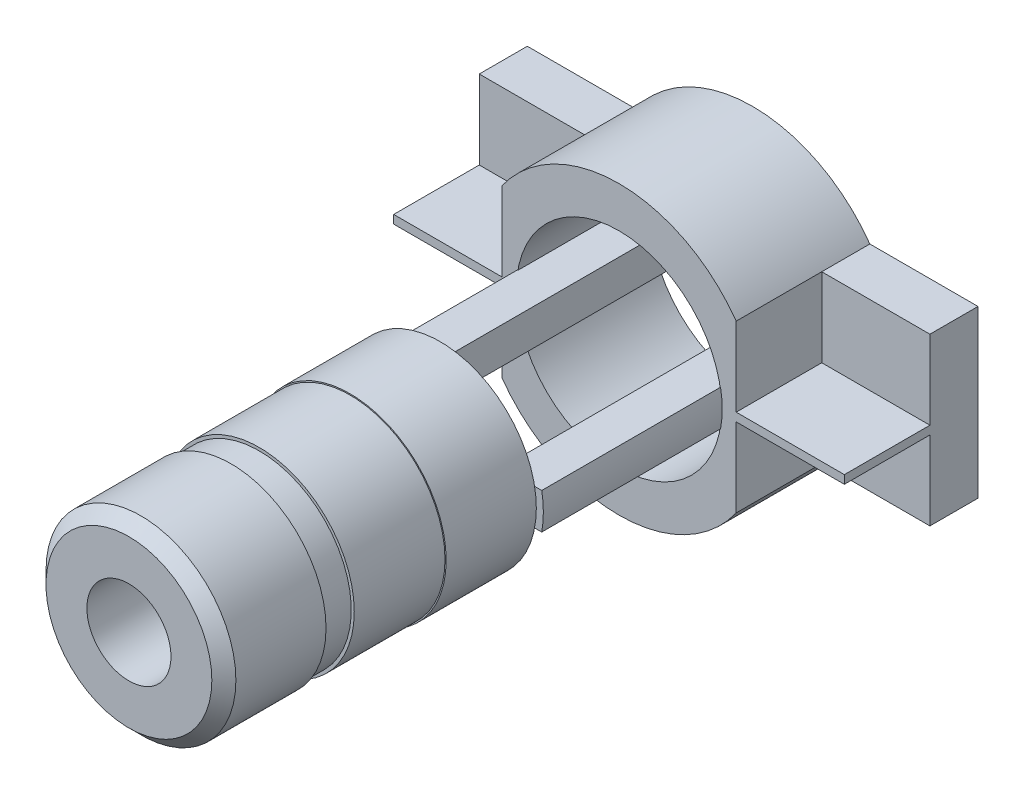
from build123d import *

# Parameters (mm, degrees)
SKETCH1_R             = 7.9
SKETCH1_R_2           = 3.5
BOSS_EXTRUDE1_DEPTH   = 18.4
CHAMFER1_SIZE         = 1
CUT_EXTRUDE6_START    = 2.35
SKETCH19_R            = 7.9
SKETCH19_R_2          = 7.65
CUT_EXTRUDE6_DEPTH    = 2.35
SKETCH24_R            = 8
BOSS_EXTRUDE5_DEPTH   = 7.5
BOSS_EXTRUDE6_DEPTH   = 26
BOSS_EXTRUDE6_2_DEPTH = 26
SKETCH26_R            = 11.95
SKETCH26_R_2          = 8.55
BOSS_EXTRUDE7_DEPTH   = 11.12
CUT_EXTRUDE9_DEPTH    = 45.143101386
SKETCH28_R            = 3.5
CUT_EXTRUDE10_DEPTH   = 31.230200132
SKETCH29_W            = 4
SKETCH29_H            = 13.818827736
BOSS_EXTRUDE8_DEPTH   = 9
SKETCH30_W            = 4
SKETCH30_H            = 13.818827736
BOSS_EXTRUDE9_DEPTH   = 9
BOSS_EXTRUDE10_DEPTH  = 9
BOSS_EXTRUDE11_DEPTH  = 9


with BuildPart() as part:
    # Sketch1 → Boss-Extrude1 (new body)
    with BuildSketch(Plane.XY):
        Circle(SKETCH1_R)
        Circle(SKETCH1_R_2, mode=Mode.SUBTRACT)
    extrude(amount=BOSS_EXTRUDE1_DEPTH)

    # Chamfer1
    chamfer1_edges = [part.edges().sort_by_distance(p)[0] for p in [
        (-7.9, 0, 18.4),
    ]]
    chamfer(chamfer1_edges, length=CHAMFER1_SIZE)

    # Sketch19 → Cut-Extrude6 (cut)
    with BuildSketch(Plane(origin=(0, 0, 9.9), x_dir=(-1, 0, 0), z_dir=(0, 0, -1)).offset(CUT_EXTRUDE6_START)):
        Circle(SKETCH19_R)
        Circle(SKETCH19_R_2, mode=Mode.SUBTRACT)
    extrude(amount=-CUT_EXTRUDE6_DEPTH, mode=Mode.SUBTRACT)


with BuildPart() as body_2:
    # Sketch24 → Boss-Extrude5 (new body)
    with BuildSketch(Plane(origin=(0, 0, 0), x_dir=(-1, 0, 0), z_dir=(0, 0, -1))):
        Circle(SKETCH24_R)
    extrude(amount=BOSS_EXTRUDE5_DEPTH)

    # Sketch28 → Cut-Extrude10 (cut, through all)
    with BuildSketch(Plane(origin=(0, 0, -7.5), x_dir=(-1, 0, 0), z_dir=(0, 0, -1))):
        Circle(SKETCH28_R)
    extrude(amount=-CUT_EXTRUDE10_DEPTH, mode=Mode.SUBTRACT)


with BuildPart() as body_3:
    # Sketch25 → Boss-Extrude6 (new body)
    with BuildSketch(Plane(origin=(0, 0, -7.5), x_dir=(-1, 0, 0), z_dir=(0, 0, -1))):
        with BuildLine():
            Line((-5.15, 1.5), (-8.45, 1.5))
            ThreePointArc((-8.45, 1.5), (-8.549984118, 0.752960074), (-8.583399735, 0))
            ThreePointArc((-8.583399735, 0), (-8.549984118, -0.752960074), (-8.45, -1.5))
            Line((-8.45, -1.5), (-5.15, -1.5))
            Line((-5.15, -1.5), (-5.15, 0))
            Line((-5.15, 0), (-5.15, 1.5))
        make_face()
    extrude(amount=BOSS_EXTRUDE6_DEPTH)


with BuildPart() as body_4:
    # Sketch25 → Boss-Extrude6 2 (new body)
    with BuildSketch(Plane(origin=(0, 0, -7.5), x_dir=(-1, 0, 0), z_dir=(0, 0, -1))):
        with BuildLine():
            Line((5.15, 1.5), (5.15, 0))
            Line((5.15, 0), (5.15, -1.5))
            Line((5.15, -1.5), (8.45, -1.5))
            ThreePointArc((8.45, -1.5), (8.549984118, -0.752960074), (8.583399735, 0))
            ThreePointArc((8.583399735, 0), (8.549984118, 0.752960074), (8.45, 1.5))
            Line((8.45, 1.5), (5.15, 1.5))
        make_face()
    extrude(amount=BOSS_EXTRUDE6_2_DEPTH)


with BuildPart() as body_5:
    # Sketch26 → Boss-Extrude7 (new body)
    with BuildSketch(Plane(origin=(0, 0, -33.5), x_dir=(-1, 0, 0), z_dir=(0, 0, -1))):
        Circle(SKETCH26_R)
        Circle(SKETCH26_R_2, mode=Mode.SUBTRACT)
    extrude(amount=-BOSS_EXTRUDE7_DEPTH)

    # Sketch27 → Cut-Extrude9 (cut, through all)
    with BuildSketch(Plane.XY.offset(-22.38)):
        with BuildLine():
            Line((-9.75, 0), (-9.75, 6.909413868))
            ThreePointArc((-9.75, 6.909413868), (-11.95, 0), (-9.75, -6.909413868))
            Line((-9.75, -6.909413868), (-9.75, 0))
        make_face()
        with BuildLine():
            Line((9.75, 0), (9.75, 6.909413868))
            ThreePointArc((9.75, 6.909413868), (11.95, 0), (9.75, -6.909413868))
            Line((9.75, -6.909413868), (9.75, 0))
        make_face()
    extrude(amount=-CUT_EXTRUDE9_DEPTH, mode=Mode.SUBTRACT)

    # Sketch29 → Boss-Extrude8 (add)
    with BuildSketch(Plane.ZY.offset(9.75)):
        with Locations((-31.5, 0)):
            Rectangle(SKETCH29_W, SKETCH29_H)
    extrude(amount=BOSS_EXTRUDE8_DEPTH)

    # Sketch30 → Boss-Extrude9 (add)
    with BuildSketch(Plane(origin=(9.75, 0, 0), x_dir=(0, 0, -1), z_dir=(1, 0, 0))):
        with Locations((31.5, 0)):
            Rectangle(SKETCH30_W, SKETCH30_H)
    extrude(amount=BOSS_EXTRUDE9_DEPTH)

    # Sketch31 → Boss-Extrude10 (add)
    with BuildSketch(Plane(origin=(9.75, 0, 0), x_dir=(0, 0, -1), z_dir=(1, 0, 0))):
        Polygon((22.38, 0), (22.38, 0.35), (29.5, 0.35), (29.5, -0.35), (22.38, -0.35), align=None)
    extrude(amount=BOSS_EXTRUDE10_DEPTH)

    # Sketch32 → Boss-Extrude11 (add)
    with BuildSketch(Plane.ZY.offset(9.75)):
        Polygon((-22.38, 0), (-22.38, 0.35), (-29.5, 0.35), (-29.5, -0.35), (-22.38, -0.35), align=None)
    extrude(amount=BOSS_EXTRUDE11_DEPTH)


solid = Compound([part.part, body_2.part, body_3.part, body_4.part, body_5.part])
